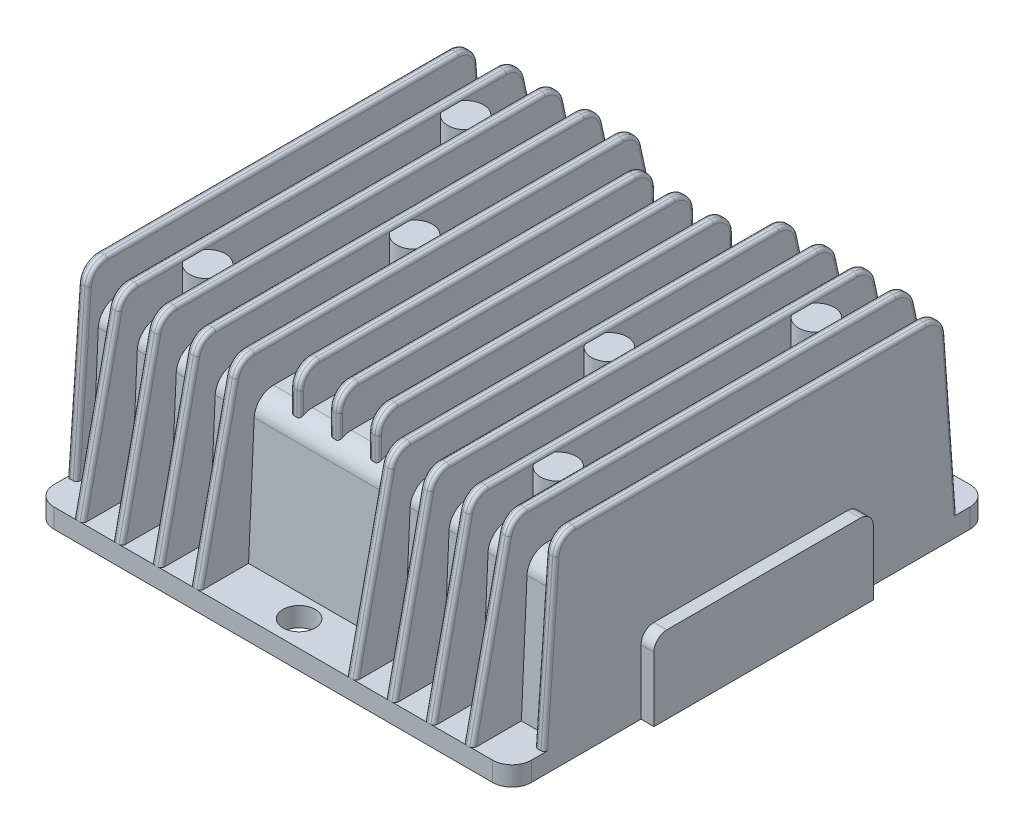
from build123d import *

# Parameters (mm, degrees)
BOSS_EXTRUDE1_DEPTH             = 3
SKETCH2_R                       = 2.5
CUT_EXTRUDE1_DEPTH              = 53.411830726
BOSS_EXTRUDE2_REACH             = 54.412
BOSS_EXTRUDE2_DIRECTION_2_REACH = 54.412
SKETCH4_W                       = 1.5
SKETCH4_H                       = 74
SKETCH4_H_2                     = 64
SKETCH4_H_3                     = 55
BOSS_EXTRUDE3_DEPTH             = 28
CUT_EXTRUDE3_DEPTH              = 2
CUT_EXTRUDE2_DEPTH              = 61.819404798
FILLET2_R                       = 3
FILLET3_R                       = 0.5
SKETCH8_R                       = 2.770833333
BOSS_EXTRUDE5_DEPTH             = 5.5
BOSS_EXTRUDE4_DEPTH             = 2


# Read off the part's stored shape, not the designer's step: Mirror1
with BuildPart() as part:
    # Sketch1 → Boss-Extrude1 (new body)
    with BuildSketch(Plane(origin=(0, 0, 0), x_dir=(1, 0, 0), z_dir=(0, 1, 0))):
        with BuildLine():
            Line((-34, 37), (34, 37))
            ThreePointArc((34, 37), (36.121320344, 36.121320344), (37, 34))
            Line((37, 34), (37, -34))
            ThreePointArc((37, -34), (36.121320344, -36.121320344), (34, -37))
            Line((34, -37), (-34, -37))
            ThreePointArc((-34, -37), (-36.121320344, -36.121320344), (-37, -34))
            Line((-37, -34), (-37, 34))
            ThreePointArc((-37, 34), (-36.121320344, 36.121320344), (-34, 37))
        make_face()
    extrude(amount=BOSS_EXTRUDE1_DEPTH)

    # Sketch2 → Cut-Extrude1 (cut, through all)
    with BuildSketch(Plane(origin=(0, 3, 0), x_dir=(1, 0, 0), z_dir=(0, 1, 0))):
        with Locations(Location((0, 33, 0), (0, 0, 270))):
            Circle(SKETCH2_R)
        with Locations(Location((0, -33, 0), (0, 0, 270))):
            Circle(SKETCH2_R)
    extrude(amount=-CUT_EXTRUDE1_DEPTH, mode=Mode.SUBTRACT)

    # Boss-Extrude2: up to this face of the body (flat: up to its plane)
    boss_extrude2_end = Plane(part.part.faces().sort_by_distance((37, 1.5, 0))[0])
    # Sketch3 → Boss-Extrude2 (add, up to the picked face)
    with BuildSketch(Plane(origin=(0, 0, 0), x_dir=(0, 0, -1), z_dir=(1, 0, 0)), mode=Mode.PRIVATE) as boss_extrude2_sk1:
        with BuildLine():
            Line((29.5, 3), (28.630171683, 22.136222983))
            ThreePointArc((28.630171683, 22.136222983), (27.705864799, 24.16894778), (25.633266062, 25))
            Line((25.633266062, 25), (-25.633266062, 25))
            ThreePointArc((-25.633266062, 25), (-27.705864799, 24.16894778), (-28.630171683, 22.136222983))
            Line((-28.630171683, 22.136222983), (-29.5, 3))
            Line((-29.5, 3), (29.5, 3))
        make_face()
    boss_extrude2_tool1 = split(extrude(boss_extrude2_sk1.sketch, amount=BOSS_EXTRUDE2_REACH, mode=Mode.PRIVATE), bisect_by=boss_extrude2_end, keep=Keep.BOTH, mode=Mode.PRIVATE)
    add(boss_extrude2_tool1.solids().sort_by(Axis((0, 13.90833, 0), (1, 0, 0)))[0])

    # Boss-Extrude2 direction 2: up to this face of the body (flat: up to its plane)
    boss_extrude2_direction_2_end = Plane(part.part.faces().sort_by_distance((-37, 1.5, 0))[0])
    # Sketch3 → Boss-Extrude2 direction 2 (add, up to the picked face)
    with BuildSketch(Plane(origin=(0, 0, 0), x_dir=(0, 0, -1), z_dir=(1, 0, 0)), mode=Mode.PRIVATE) as boss_extrude2_direction_2_sk1:
        with BuildLine():
            Line((29.5, 3), (28.630171683, 22.136222983))
            ThreePointArc((28.630171683, 22.136222983), (27.705864799, 24.16894778), (25.633266062, 25))
            Line((25.633266062, 25), (-25.633266062, 25))
            ThreePointArc((-25.633266062, 25), (-27.705864799, 24.16894778), (-28.630171683, 22.136222983))
            Line((-28.630171683, 22.136222983), (-29.5, 3))
            Line((-29.5, 3), (29.5, 3))
        make_face()
    boss_extrude2_direction_2_tool1 = split(extrude(boss_extrude2_direction_2_sk1.sketch, amount=-BOSS_EXTRUDE2_DIRECTION_2_REACH, mode=Mode.PRIVATE), bisect_by=boss_extrude2_direction_2_end, keep=Keep.BOTH, mode=Mode.PRIVATE)
    add(boss_extrude2_direction_2_tool1.solids().sort_by(Axis((0, 13.90833, 0), (-1, 0, 0)))[0])

    # Sketch4 → Boss-Extrude3 (add)
    with BuildSketch(Plane(origin=(0, 3, 0), x_dir=(1, 0, 0), z_dir=(0, 1, 0))):
        with Locations((30.208333333, 0)):
            Rectangle(SKETCH4_W, SKETCH4_H)
        with Locations((18.125, 0)):
            Rectangle(SKETCH4_W, SKETCH4_H)
        with Locations((24.166666667, 0)):
            Rectangle(SKETCH4_W, SKETCH4_H)
        with Locations((12.083333333, 0)):
            Rectangle(SKETCH4_W, SKETCH4_H)
        with Locations((36.25, 0)):
            Rectangle(SKETCH4_W, SKETCH4_H_2)
        with Locations((6.041666667, 0)):
            Rectangle(SKETCH4_W, SKETCH4_H_3)
        Rectangle(SKETCH4_W, SKETCH4_H_3)
    extrude(amount=BOSS_EXTRUDE3_DEPTH)

    # Sketch6 → Cut-Extrude3 (cut)
    with BuildSketch(Plane(origin=(37, 0, 0), x_dir=(0, 0, -1), z_dir=(1, 0, 0))):
        Polygon((-32, 3), (-30, 31), (-32, 31), align=None)
        Polygon((32, 31), (32, 3), (30, 31), align=None)
    extrude(amount=-CUT_EXTRUDE3_DEPTH, mode=Mode.SUBTRACT)

    # Sketch5 → Cut-Extrude2 (cut, symmetric)
    with BuildSketch(Plane(origin=(0, 0, 0), x_dir=(0, 0, -1), z_dir=(1, 0, 0))):
        Polygon((-37, 3), (-31, 31), (-37, 31), align=None)
        Polygon((37, 31), (37, 3), (31, 31), align=None)
    extrude(amount=CUT_EXTRUDE2_DEPTH, both=True, mode=Mode.SUBTRACT)

    # Fillet2
    fillet2_edges = [part.edges().sort_by_distance(p)[0] for p in [
        (6.041666667, 31, 27.5),
        (6.041666667, 31, -27.5),
        (0, 31, 27.5),
        (0, 31, -27.5),
        (36.25, 31, -30),
        (36.25, 31, 30),
        (12.083333333, 31, -31),
        (12.083333333, 31, 31),
        (30.208333333, 31, 31),
        (18.125, 31, 31),
        (24.166666667, 31, 31),
        (30.208333333, 31, -31),
        (18.125, 31, -31),
        (24.166666667, 31, -31),
    ]]
    fillet(fillet2_edges, radius=FILLET2_R)

    # Fillet3
    fillet3_edges = [part.edges().sort_by_distance(p)[0] for p in [
        (35.5, 15.606870575, 31.099509245),
        (37, 15.606870575, 31.099509245),
        (29.458333333, 15.814293633, 34.254079936),
        (17.375, 15.814293633, 34.254079936),
        (23.416666667, 15.814293633, 34.254079936),
        (11.333333333, 15.814293633, 34.254079936),
        (30.958333333, 15.814293633, -34.254079936),
        (18.875, 15.814293633, -34.254079936),
        (24.916666667, 15.814293633, -34.254079936),
        (12.833333333, 15.814293633, -34.254079936),
        (-0.75, 31, 0),
        (0.75, 31, 0),
        (-0.75, 26.174234262, 27.5),
        (-0.75, 26.174234262, -27.5),
        (-0.75, 30.121320344, 26.621320344),
        (-0.75, 30.121320344, -26.621320344),
        (0.75, 26.174234262, -27.5),
        (0.75, 26.174234262, 27.5),
        (0.75, 30.121320344, 26.621320344),
        (0.75, 30.121320344, -26.621320344),
        (5.291666667, 31, 0),
        (6.791666667, 31, 0),
        (5.291666667, 26.174234262, 27.5),
        (5.291666667, 26.174234262, -27.5),
        (5.291666667, 30.121320344, 26.621320344),
        (5.291666667, 30.121320344, -26.621320344),
        (6.791666667, 26.174234262, -27.5),
        (6.791666667, 26.174234262, 27.5),
        (6.791666667, 30.121320344, 26.621320344),
        (6.791666667, 30.121320344, -26.621320344),
        (11.333333333, 31, 0),
        (12.833333333, 31, 0),
        (11.333333333, 15.814293633, -34.254079936),
        (11.333333333, 30.332998264, 30.460785264),
        (11.333333333, 30.332998264, -30.460785264),
        (12.833333333, 15.814293633, 34.254079936),
        (12.833333333, 30.332998264, 30.460785264),
        (12.833333333, 30.332998264, -30.460785264),
        (17.375, 15.814293633, -34.254079936),
        (18.875, 31, 0),
        (18.875, 15.814293633, 34.254079936),
        (18.875, 30.332998264, 30.460785264),
        (18.875, 30.332998264, -30.460785264),
        (17.375, 31, 0),
        (17.375, 30.332998264, 30.460785264),
        (17.375, 30.332998264, -30.460785264),
        (23.416666667, 15.814293633, -34.254079936),
        (24.916666667, 31, 0),
        (24.916666667, 15.814293633, 34.254079936),
        (24.916666667, 30.332998264, 30.460785264),
        (24.916666667, 30.332998264, -30.460785264),
        (23.416666667, 31, 0),
        (23.416666667, 30.332998264, 30.460785264),
        (23.416666667, 30.332998264, -30.460785264),
        (29.458333333, 15.814293633, -34.254079936),
        (30.958333333, 31, 0),
        (30.958333333, 15.814293633, 34.254079936),
        (30.958333333, 30.332998264, 30.460785264),
        (30.958333333, 30.332998264, -30.460785264),
        (29.458333333, 31, 0),
        (29.458333333, 30.332998264, 30.460785264),
        (29.458333333, 30.332998264, -30.460785264),
        (35.5, 31, 0),
        (37, 31, 0),
        (35.5, 15.606870575, -31.099509245),
        (35.5, 30.195589152, 29.250997612),
        (35.5, 30.195589152, -29.250997612),
        (37, 15.606870575, -31.099509245),
        (37, 30.195589152, 29.250997612),
        (37, 30.195589152, -29.250997612),
    ]]
    fillet(fillet3_edges, radius=FILLET3_R)

    # Sketch8 → Boss-Extrude5 (add)
    with BuildSketch(Plane(origin=(0, 25, 0), x_dir=(1, 0, 0), z_dir=(0, 1, 0))):
        with Locations((15.104166667, 0)):
            Circle(SKETCH8_R)
        with Locations((27.1875, 20)):
            Circle(SKETCH8_R)
        with Locations((27.1875, -20)):
            Circle(SKETCH8_R)
    extrude(amount=BOSS_EXTRUDE5_DEPTH)

    # Mirror1: part across plane


with BuildPart() as part_1:
    add(part.part)
    add(part.part.mirror(Plane(origin=(0, 0, 0), x_dir=(0, 0, 1), z_dir=(1, 0, 0))))


with BuildPart() as body_2:
    # Sketch7 → Boss-Extrude4 (new body)
    with BuildSketch(Plane(origin=(37, 0, 0), x_dir=(0, 0, -1), z_dir=(1, 0, 0))):
        with BuildLine():
            Line((-17, 0), (17, 0))
            Line((17, 0), (17, 10))
            ThreePointArc((17, 10), (16.414213562, 11.414213562), (15, 12))
            Line((15, 12), (-15, 12))
            ThreePointArc((-15, 12), (-16.414213562, 11.414213562), (-17, 10))
            Line((-17, 10), (-17, 0))
        make_face()
    extrude(amount=BOSS_EXTRUDE4_DEPTH)


solid = Compound([part_1.part, body_2.part])
